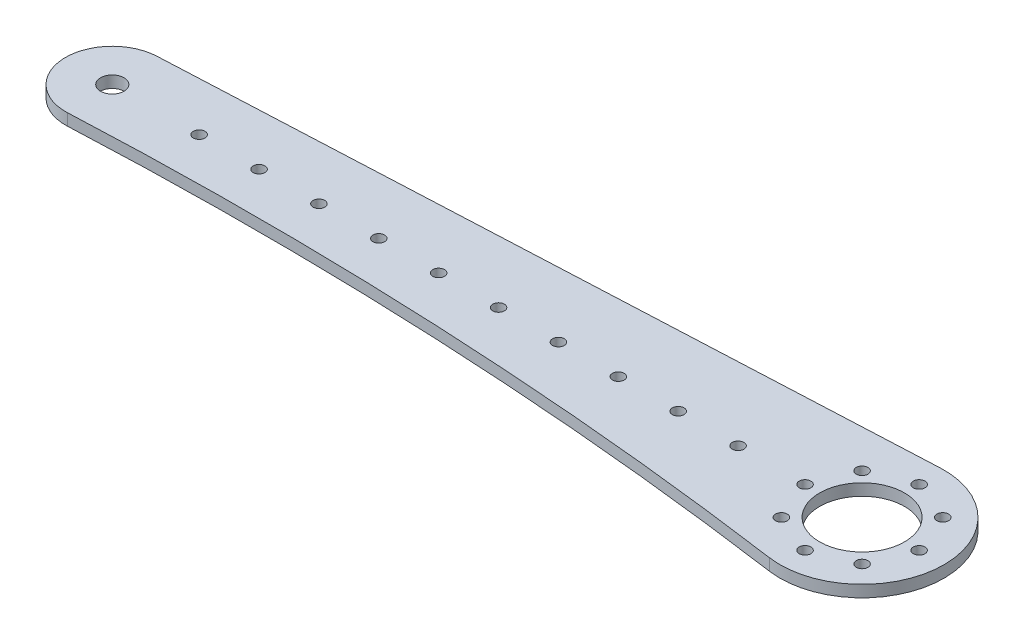
from build123d import *

# Parameters (mm, degrees)
SKETCH2_R               = 11.499999987
SKETCH2_R_2             = 1.5875
BOSS_EXTRUDE1_DEPTH     = 1.5875
CUT_EXTRUDE1_DEPTH      = 218.04672488
CUT_EXTRUDE1_DEPTH_BACK = 218.04672488
SKETCH3_R               = 1.5875
CUT_EXTRUDE2_DEPTH      = 218.04672488
CUT_EXTRUDE2_DEPTH_BACK = 218.04672488
SKETCH4_R               = 3.175


with BuildPart() as part:
    # Sketch2 → Boss-Extrude1 (new, symmetric)
    with BuildSketch(Plane(origin=(0, 0, 0), x_dir=(1, 0, 0), z_dir=(0, 1, 0))):
        with BuildLine():
            Line((-203.7953125, 12.68603969), (-1.041796875, 22.200569458))
            ThreePointArc((-1.041796875, 22.200569458), (22.20078289, -1.037238675), (-3.107197713, -22.006725049))
            ThreePointArc((-3.107197713, -22.006725049), (-102.637728125, -12.675777179), (-202.6046875, -12.68603969))
            ThreePointArc((-202.6046875, -12.68603969), (-215.88603969, -0.5953125), (-203.7953125, 12.68603969))
        make_face()
        Circle(SKETCH2_R, mode=Mode.SUBTRACT)
        with Locations((-10.93294263, 10.93294263)):
            Circle(SKETCH2_R_2, mode=Mode.SUBTRACT)
        with Locations((0, 15.461515744)):
            Circle(SKETCH2_R_2, mode=Mode.SUBTRACT)
        with Locations((10.93294263, 10.93294263)):
            Circle(SKETCH2_R_2, mode=Mode.SUBTRACT)
        with Locations((15.461515744, 0)):
            Circle(SKETCH2_R_2, mode=Mode.SUBTRACT)
        with Locations((10.93294263, -10.93294263)):
            Circle(SKETCH2_R_2, mode=Mode.SUBTRACT)
        with Locations((0, -15.461515744)):
            Circle(SKETCH2_R_2, mode=Mode.SUBTRACT)
        with Locations((-10.93294263, -10.93294263)):
            Circle(SKETCH2_R_2, mode=Mode.SUBTRACT)
        with Locations((-15.461515744, 0)):
            Circle(SKETCH2_R_2, mode=Mode.SUBTRACT)
    extrude(amount=BOSS_EXTRUDE1_DEPTH, both=True)

    # Sketch3 → Cut-Extrude1 (cut, two sides: drawn at the far end of the back side and taken through both)
    with BuildSketch(Plane(origin=(0, 0, 0), x_dir=(1, 0, 0), z_dir=(0, 1, 0)).offset(-CUT_EXTRUDE1_DEPTH_BACK)):
        with Locations((-179.65339075, 0)):
            Circle(SKETCH3_R)
        with Locations((-163.425612972, 0)):
            Circle(SKETCH3_R)
        with Locations((-147.197835195, 0)):
            Circle(SKETCH3_R)
        with Locations((-130.970057417, 0)):
            Circle(SKETCH3_R)
        with Locations((-114.742279639, 0)):
            Circle(SKETCH3_R)
        with Locations((-98.514501861, 0)):
            Circle(SKETCH3_R)
        with Locations((-82.286724083, 0)):
            Circle(SKETCH3_R)
        with Locations((-66.058946306, 0)):
            Circle(SKETCH3_R)
        with Locations((-49.831168528, 0)):
            Circle(SKETCH3_R)
        with Locations((-33.60339075, 0)):
            Circle(SKETCH3_R)
    extrude(amount=CUT_EXTRUDE1_DEPTH + CUT_EXTRUDE1_DEPTH_BACK, mode=Mode.SUBTRACT)

    # Sketch4 → Cut-Extrude2 (cut, two sides: drawn at the far end of the back side and taken through both)
    with BuildSketch(Plane.XZ.offset(-CUT_EXTRUDE2_DEPTH_BACK)):
        with Locations((-203.2, 0)):
            Circle(SKETCH4_R)
    extrude(amount=CUT_EXTRUDE2_DEPTH + CUT_EXTRUDE2_DEPTH_BACK, mode=Mode.SUBTRACT)


solid = part.part
